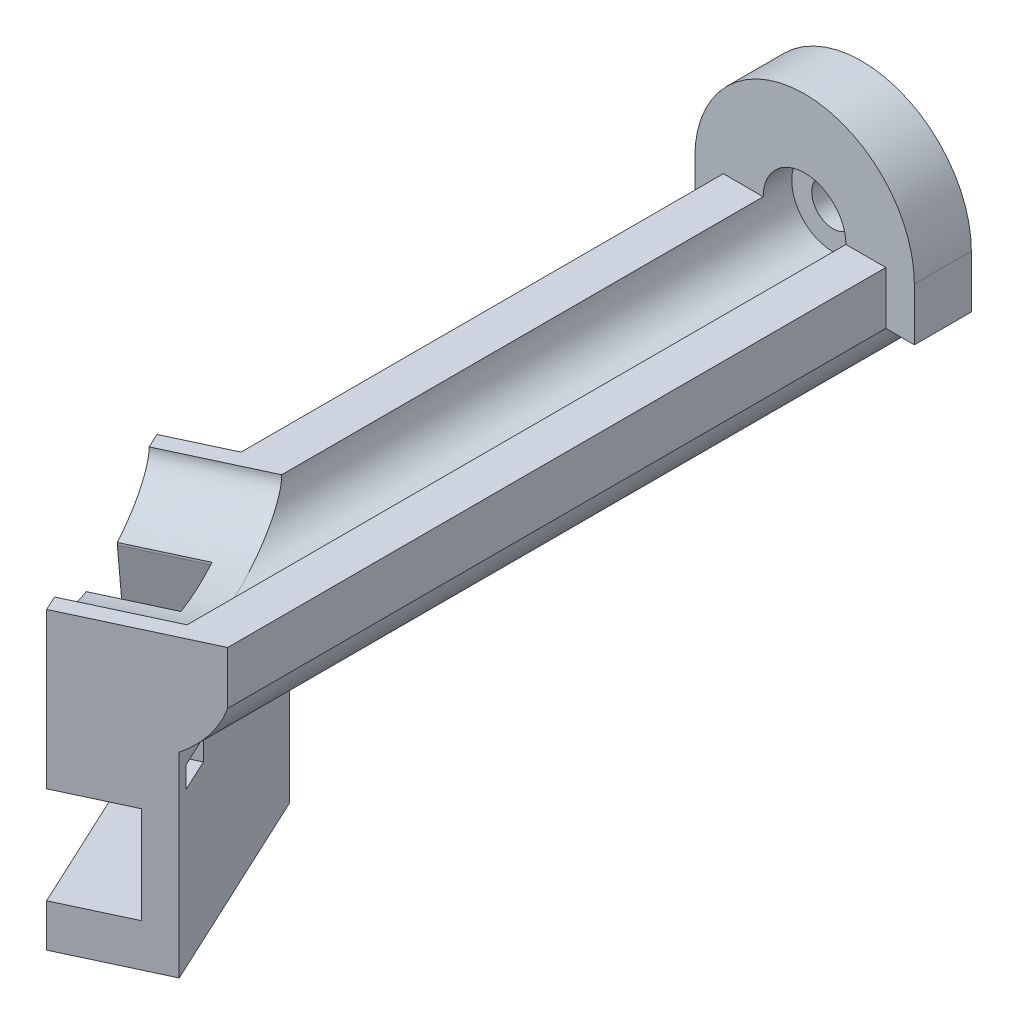
from build123d import *

# Parameters (mm, degrees)
CROQUIS1_R                = 1.5
SALIENTE_EXTRUIR1_DEPTH   = 4
CROQUIS2_R                = 2.9
CORTAR_EXTRUIR1_DEPTH     = 2
SALIENTE_EXTRUIR2_DEPTH   = 65
CORTAR_EXTRUIR2_OUTLINE_W = 7.281077338
CORTAR_EXTRUIR2_OUTLINE_H = 8.780929931
CORTAR_EXTRUIR2_DEPTH     = 8.6
CORTAR_EXTRUIR2_TAPER     = -65
CROQUIS5_W                = 41.142355125
CROQUIS5_H                = 35.377069929
CORTAR_EXTRUIR3_DEPTH     = 10
SALIENTE_EXTRUIR3_DEPTH   = 7
CORTAR_EXTRUIR4_DEPTH     = 5
CORTAR_EXTRUIR5_START     = -7
CROQUIS8_W                = 2.5
CROQUIS8_H                = 1.5
CORTAR_EXTRUIR5_DEPTH     = 7
CORTAR_EXTRUIR6_DEPTH     = 10
SALIENTE_EXTRUIR4_DEPTH   = 3.7
SALIENTE_EXTRUIR5_DEPTH   = 2.558793
CORTAR_EXTRUIR7_DEPTH     = 10
CROQUIS14_W               = 20.903204772
CROQUIS14_H               = 28.789293723
CORTAR_EXTRUIR8_DEPTH     = 10
SALIENTE_EXTRUIR6_START   = -4
CROQUIS15_R               = 1.5
SALIENTE_EXTRUIR6_DEPTH   = 4
CROQUIS16_R               = 2.9
CORTAR_EXTRUIR9_DEPTH     = 2
SALIENTE_EXTRUIR7_START   = -4
SALIENTE_EXTRUIR7_DEPTH   = 4


# Read off the part's stored shape, not the designer's step: Cortar-Extruir2
with BuildPart() as part:
    # Croquis1 → Saliente-Extruir1 (new body)
    with BuildSketch(Plane.XY):
        with BuildLine():
            Line((-55.370631899, 7.045687646), (-55.370631899, 3.345687646))
            ThreePointArc((-55.370631899, 3.345687646), (-61.070631899, -0.995420457), (-66.770631899, 3.345687646))
            Line((-66.770631899, 3.345687646), (-66.770631899, 7.045687646))
            ThreePointArc((-66.770631899, 7.045687646), (-61.070631899, 12.745687646), (-55.370631899, 7.045687646))
        make_face()
        with Locations((-61.070631899, 7.045687646)):
            Circle(CROQUIS1_R, mode=Mode.SUBTRACT)
    extrude(amount=SALIENTE_EXTRUIR1_DEPTH)

    # Croquis2 → Cortar-Extruir1 (cut)
    with BuildSketch(Plane.XY.offset(4)):
        with Locations((-61.070631899, 7.045687646)):
            Circle(CROQUIS2_R)
    extrude(amount=-CORTAR_EXTRUIR1_DEPTH, mode=Mode.SUBTRACT)

    # Croquis3 → Saliente-Extruir2 (add)
    with BuildSketch(Plane.XY.offset(4)):
        with BuildLine():
            Line((-63.970631899, 7.045687646), (-66.770631899, 7.045687646))
            Line((-66.770631899, 7.045687646), (-66.770631899, 3.345687646))
            ThreePointArc((-66.770631899, 3.345687646), (-61.070631899, -0.995420457), (-55.370631899, 3.345687646))
            Line((-55.370631899, 3.345687646), (-55.370631899, 7.045687646))
            Line((-55.370631899, 7.045687646), (-58.170631899, 7.045687646))
            ThreePointArc((-58.170631899, 7.045687646), (-61.070631899, 4.145687646), (-63.970631899, 7.045687646))
        make_face()
    extrude(amount=SALIENTE_EXTRUIR2_DEPTH)

    # Cortar-Extruir2 outline → Cortar-Extruir2 (cut)
    with BuildSketch(Plane.YZ.offset(-58.170631899)):
        with Locations((3.405148977, 64.609535034)):
            Rectangle(CORTAR_EXTRUIR2_OUTLINE_W, CORTAR_EXTRUIR2_OUTLINE_H)
    extrude(amount=-CORTAR_EXTRUIR2_DEPTH, taper=CORTAR_EXTRUIR2_TAPER, mode=Mode.SUBTRACT)

    # Croquis5 → Cortar-Extruir3 (cut)
    with BuildSketch(Plane(origin=(-70.846238664, 0, 33.03614364), x_dir=(0.422618261740701, 0, 0.9063077870366493), z_dir=(-0.9063077870366493, 1.4037441023509523e-15, 0.422618261740701))):
        with Locations((23.845262034, -3.548141358)):
            Rectangle(CROQUIS5_W, CROQUIS5_H)
    extrude(amount=CORTAR_EXTRUIR3_DEPTH, mode=Mode.SUBTRACT)

    # Croquis6 → Saliente-Extruir3 (add)
    with BuildSketch(Plane(origin=(-70.846238664, 0, 33.03614364), x_dir=(0.422618261740701, 0, 0.9063077870366493), z_dir=(-0.9063077870366493, 1.4037441023509523e-15, 0.422618261740701))):
        with BuildLine():
            Line((31.131056203, 7.045687646), (29.993040795, 7.045687646))
            add(Edge.make_bspline(
                [(16.269071612, 7.045687646), (16.269071612, 4.145687646), (23.131056203, 4.145687646), (29.993040795, 4.145687646), (29.993040795, 7.045687646)],
                knots=[3.141592654, 3.141592654, 3.141592654, 4.71238898, 4.71238898, 6.283185307, 6.283185307, 6.283185307], degree=2, weights=[1, 0.707106781, 1, 0.707106781, 1]))
            Line((16.269071612, 7.045687646), (15.131056203, 7.045687646))
            Line((15.131056203, 7.045687646), (15.131056203, -13.654312354))
            Line((15.131056203, -13.654312354), (31.131056203, -13.654312354))
            Line((31.131056203, -13.654312354), (31.131056203, 7.045687646))
        make_face()
    extrude(amount=SALIENTE_EXTRUIR3_DEPTH)

    # Croquis7 → Cortar-Extruir4 (cut)
    with BuildSketch(Plane(origin=(-77.190393173, 0, 35.994471473), x_dir=(0.42261826174070094, 0, 0.9063077870366492), z_dir=(-0.9063077870366493, 1.403744102350952e-15, 0.422618261740701))):
        with BuildLine():
            Line((25.381056203, 4.145687646), (26.731056203, -3.854312354))
            Line((26.731056203, -3.854312354), (31.131056203, -3.854312354))
            Line((31.131056203, -3.854312354), (31.131056203, -10.654312354))
            Line((31.131056203, -10.654312354), (15.131056203, -10.654312354))
            Line((15.131056203, -10.654312354), (15.131056203, -3.854312354))
            Line((15.131056203, -3.854312354), (19.531056203, -3.854312354))
            Line((19.531056203, -3.854312354), (20.881056203, 4.145687646))
            Line((20.881056203, 4.145687646), (20.881056203, 4.306015013))
            add(Edge.make_bspline(
                [(20.881056203, 4.306015013), (23.131056203, 3.97597782), (25.381056203, 4.306015013)],
                knots=[4.378316067, 4.378316067, 4.378316067, 5.046461894, 5.046461894, 5.046461894], degree=2, weights=[1, 0.944714701, 1]))
            Line((25.381056203, 4.306015013), (25.381056203, 4.145687646))
        make_face()
    extrude(amount=-CORTAR_EXTRUIR4_DEPTH, mode=Mode.SUBTRACT)

    # Croquis8 → Cortar-Extruir5 (cut)
    with BuildSketch(Plane(origin=(-77.190393173, 0, 35.994471473), x_dir=(0.42261826174070094, 0, 0.9063077870366492), z_dir=(-0.9063077870366493, 1.403744102350952e-15, 0.422618261740701)).offset(CORTAR_EXTRUIR5_START)):
        with Locations((17.381056203, -2.104312354)):
            Rectangle(CROQUIS8_W, CROQUIS8_H)
        with Locations((28.881056203, -2.104312354)):
            Rectangle(CROQUIS8_W, CROQUIS8_H)
    extrude(amount=CORTAR_EXTRUIR5_DEPTH, mode=Mode.SUBTRACT)

    # Croquis9 → Cortar-Extruir6 (cut)
    with BuildSketch(Plane(origin=(0, 7.045687646, 0), x_dir=(1, 0, 0), z_dir=(0, 1, 0))):
        Polygon((-57.689685805, -61.250462296), (-55.370631899, -60.1690697), (-55.370631899, -66.223689447), align=None)
    extrude(amount=-CORTAR_EXTRUIR6_DEPTH, mode=Mode.SUBTRACT)

    # Croquis10 → Saliente-Extruir4 (add)
    with BuildSketch(Plane(origin=(0, 7.045687646, 0), x_dir=(1, 0, 0), z_dir=(0, 1, 0))):
        Polygon((-66.770631899, -41.776310553), (-66.770631899, -47.8309303), (-64.451577993, -46.749537704), align=None)
    extrude(amount=-SALIENTE_EXTRUIR4_DEPTH)

    # Croquis12 → Saliente-Extruir5 (add)
    with BuildSketch(Plane(origin=(-70.846238664, 0, 33.03614364), x_dir=(0.422618261740701, 0, 0.9063077870366493), z_dir=(-0.9063077870366493, 1.4037441023509523e-15, 0.422618261740701))):
        with BuildLine():
            Line((15.131056203, 3.345687646), (15.131056203, 0.066589345))
            ThreePointArc((15.131056203, 0.066589345), (12.129139109, 1.273987016), (9.64370718, 3.345687646))
            Line((9.64370718, 3.345687646), (15.131056203, 3.345687646))
        make_face()
    extrude(amount=SALIENTE_EXTRUIR5_DEPTH)

    # Croquis13 → Cortar-Extruir7 (cut)
    with BuildSketch(Plane(origin=(0, 3.345687646, 0), x_dir=(1, 0, 0), z_dir=(0, 1, 0))):
        Polygon((-66.770631899, -47.8309303), (-66.770631899, -41.776310553), (-69.089685805, -42.857703149), align=None)
    extrude(amount=-CORTAR_EXTRUIR7_DEPTH, mode=Mode.SUBTRACT)

    # Croquis14 → Cortar-Extruir8 (cut)
    with BuildSketch(Plane(origin=(0, 0, 0), x_dir=(-1, 0, 0), z_dir=(0, 0, -1))):
        with Locations((60.961327713, 6.880035774)):
            Rectangle(CROQUIS14_W, CROQUIS14_H)
    extrude(amount=-CORTAR_EXTRUIR8_DEPTH, mode=Mode.SUBTRACT)

    # Croquis15 → Saliente-Extruir6 (add)
    with BuildSketch(Plane(origin=(0, 0, 10), x_dir=(-1, 0, 0), z_dir=(0, 0, -1)).offset(SALIENTE_EXTRUIR6_START)):
        with BuildLine():
            ThreePointArc((55.370631899, 7.045687646), (61.070631899, 12.745687646), (66.770631899, 7.045687646))
            Line((66.770631899, 7.045687646), (63.970631899, 7.045687646))
            ThreePointArc((63.970631899, 7.045687646), (61.070631899, 4.145687646), (58.170631899, 7.045687646))
            Line((58.170631899, 7.045687646), (55.370631899, 7.045687646))
        make_face()
        with Locations((61.070631899, 7.045687646)):
            Circle(CROQUIS15_R, mode=Mode.SUBTRACT)
    extrude(amount=SALIENTE_EXTRUIR6_DEPTH)

    # Croquis16 → Cortar-Extruir9 (cut)
    with BuildSketch(Plane.XY.offset(14)):
        with Locations((-61.070631899, 7.045687646)):
            Circle(CROQUIS16_R)
    extrude(amount=-CORTAR_EXTRUIR9_DEPTH, mode=Mode.SUBTRACT)

    # Croquis17 → Saliente-Extruir7 (add)
    with BuildSketch(Plane(origin=(0, 0, 10), x_dir=(-1, 0, 0), z_dir=(0, 0, -1)).offset(SALIENTE_EXTRUIR7_START)):
        with BuildLine():
            Line((55.370631899, 3.345687646), (53.370631899, 3.345687646))
            Line((53.370631899, 3.345687646), (53.370631899, 7.045687646))
            ThreePointArc((53.370631899, 7.045687646), (61.070631899, 14.745687646), (68.770631899, 7.045687646))
            Line((68.770631899, 7.045687646), (68.770631899, 3.345687646))
            Line((68.770631899, 3.345687646), (66.770631899, 3.345687646))
            Line((66.770631899, 3.345687646), (66.770631899, 7.045687646))
            ThreePointArc((66.770631899, 7.045687646), (61.070631899, 12.745687646), (55.370631899, 7.045687646))
            Line((55.370631899, 7.045687646), (55.370631899, 3.345687646))
        make_face()
    extrude(amount=SALIENTE_EXTRUIR7_DEPTH)


solid = part.part
